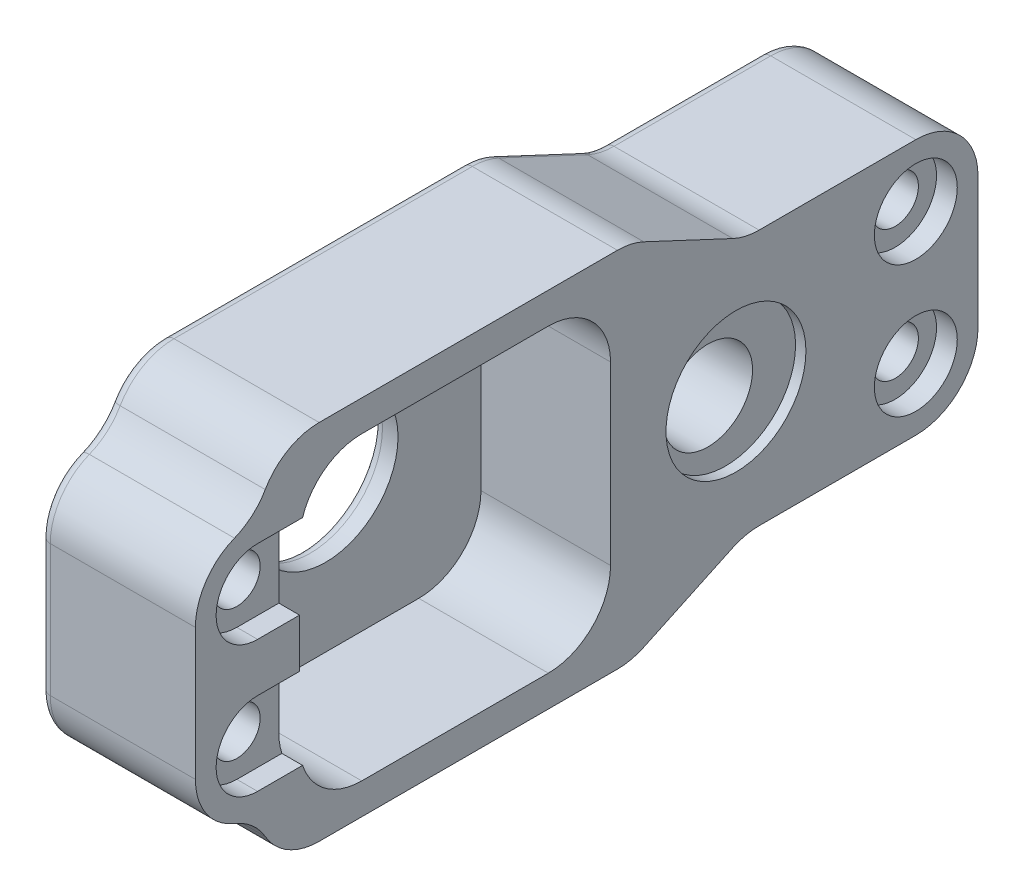
from build123d import *

# Parameters (mm, degrees)
SKETCH1_R           = 4.3
SKETCH1_R_2         = 2.25
SKETCH1_W           = 30
SKETCH1_H           = 29
BOSS_EXTRUDE1_DEPTH = 15
SKETCH1_3_W         = 30
SKETCH1_3_H         = 29
SKETCH1_3_R         = 7
BOSS_EXTRUDE2_DEPTH = 2.5
CUT_EXTRUDE1_START  = 14
SKETCH1_4_R         = 6.75
SKETCH1_4_R_2       = 4.3
CUT_EXTRUDE1_DEPTH  = 1
FILLET1_R           = 6
FILLET2_R           = 6
FILLET3_R           = 1
SKETCH2_R           = 4
CUT_EXTRUDE2_DEPTH  = 2


with BuildPart() as part:
    # Sketch1 → Boss-Extrude1 (new body)
    with BuildSketch(Plane(origin=(0, 0, 0), x_dir=(0, 0, -1), z_dir=(1, 0, 0))):
        Polygon((-19.05, 17.5), (17, 17.5), (28, 12.35), (50.45, 12.35), (50.45, -12.35), (28, -12.35), (17, -17.5), (-19.05, -17.5), (-19.05, -12.35), (-25.05, -12.35), (-25.05, 12.35), (-19.05, 12.35), align=None)
        with Locations((25.4, 0)):
            Circle(SKETCH1_R, mode=Mode.SUBTRACT)
        with Locations((-19.05, 6.35)):
            Circle(SKETCH1_R_2, mode=Mode.SUBTRACT)
        with Locations((44.45, 6.35)):
            Circle(SKETCH1_R_2, mode=Mode.SUBTRACT)
        with Locations((44.45, -6.35)):
            Circle(SKETCH1_R_2, mode=Mode.SUBTRACT)
        with Locations((-19.05, -6.35)):
            Circle(SKETCH1_R_2, mode=Mode.SUBTRACT)
        Rectangle(SKETCH1_W, SKETCH1_H, mode=Mode.SUBTRACT)
    extrude(amount=BOSS_EXTRUDE1_DEPTH)

    # Sketch1<3> → Boss-Extrude2 (add)
    with BuildSketch(Plane(origin=(0, 0, 0), x_dir=(0, 0, -1), z_dir=(1, 0, 0))):
        Rectangle(SKETCH1_3_W, SKETCH1_3_H)
        Circle(SKETCH1_3_R, mode=Mode.SUBTRACT)
    extrude(amount=BOSS_EXTRUDE2_DEPTH)

    # Sketch1<4> → Cut-Extrude1 (cut)
    with BuildSketch(Plane(origin=(0, 0, 0), x_dir=(0, 0, -1), z_dir=(1, 0, 0)).offset(CUT_EXTRUDE1_START)):
        with Locations((27.1, 0)):
            Circle(SKETCH1_4_R)
        with Locations((25.4, 0)):
            Circle(SKETCH1_4_R_2, mode=Mode.SUBTRACT)
    extrude(amount=CUT_EXTRUDE1_DEPTH, mode=Mode.SUBTRACT)

    # Fillet1
    # the kernel refuses this fillet: 6 mm, written as the material it adds along each edge
    with BuildSketch(Plane(origin=(2.5, -14.5, 15), x_dir=(0, 1, 0), z_dir=(1, 0, 0)), Plane(origin=(2.5, 14.5, 15), x_dir=(0, 0, -1), z_dir=(1, 0, 0))) as fillet1_piece_1:
        with BuildLine():
            CenterArc((FILLET1_R, -FILLET1_R), FILLET1_R, 90, 90)
            Line((0, -FILLET1_R), (0, 0))
            Line((0, 0), (FILLET1_R, 0))
        make_face()
    extrude(amount=12.5)
    with BuildSketch(Plane(origin=(2.5, -14.5, -15), x_dir=(0, 1, 0), z_dir=(1, 0, 0)), Plane(origin=(2.5, 14.5, -15), x_dir=(0, 0, 1), z_dir=(1, 0, 0))) as fillet1_piece_2:
        with BuildLine():
            CenterArc((FILLET1_R, FILLET1_R), FILLET1_R, 180, 90)
            Line((0, FILLET1_R), (0, 0))
            Line((0, 0), (FILLET1_R, 0))
        make_face()
    extrude(amount=12.5)
    with BuildSketch(Plane(origin=(0, -12.35, -28), x_dir=(0, 0, -1), z_dir=(1, 0, 0)), Plane(origin=(0, 12.35, -28), x_dir=(0, 0.42401195067886216, 0.9056565936830063), z_dir=(1, 0, 0))) as fillet1_piece_3:
        with BuildLine():
            CenterArc((FILLET1_R * 0.222501762429, -FILLET1_R), FILLET1_R, 90, 25.088139126)
            Line((-FILLET1_R * 0.20151018825, -FILLET1_R * 0.094343406317), (0, 0))
            Line((0, 0), (FILLET1_R * 0.222501762429, 0))
        make_face()
    extrude(amount=15)
    # the kernel refuses this fillet: 6 mm, written as the material it takes off along each edge
    with BuildSketch(Plane(origin=(-3.337526436, 17.5, -17), x_dir=(0, 0, 1), z_dir=(1, 0, 0)), Plane(origin=(-3.337526436, -17.5, -17), x_dir=(0, 0.4240119506788633, -0.9056565936830059), z_dir=(1, 0, 0))) as fillet1_2_piece_1:
        with BuildLine():
            CenterArc((FILLET1_R * 0.222501762429, FILLET1_R), FILLET1_R, 244.911860874, 25.088139126)
            Line((-FILLET1_R * 0.20151018825, FILLET1_R * 0.094343406317), (0, 0))
            Line((0, 0), (FILLET1_R * 0.222501762429, 0))
        make_face()
    extrude(amount=21.675052873, mode=Mode.SUBTRACT)
    with BuildSketch(Plane(origin=(-14.848716274, -17.5, 19.05), x_dir=(0, 0, -1), z_dir=(1, 0, 0))) as fillet1_2_piece_2:
        with BuildLine():
            CenterArc((5.93948651, 6), FILLET1_R, 188.144300554, 81.855699446)
            Line((0, 5.15), (0, 0))
            Line((0, 0), (5.93948651, 0))
        make_face()
    extrude(amount=44.697432549, mode=Mode.SUBTRACT)
    with BuildSketch(Plane(origin=(-14.848716274, 17.5, 19.05), x_dir=(0, 0, -1), z_dir=(1, 0, 0))) as fillet1_2_piece_3:
        with BuildLine():
            CenterArc((5.93948651, -6), FILLET1_R, 90, 81.855699446)
            Line((0, -5.15), (0, 0))
            Line((0, 0), (5.93948651, 0))
        make_face()
    extrude(amount=44.697432549, mode=Mode.SUBTRACT)
    with BuildSketch(Plane(origin=(-15, -12.35, 25.05), x_dir=(0, 0, -1), z_dir=(1, 0, 0)), Plane(origin=(-15, -12.35, -50.45), x_dir=(0, 1, 0), z_dir=(1, 0, 0)), Plane(origin=(-15, 12.35, -50.45), x_dir=(0, 0, 1), z_dir=(1, 0, 0))) as fillet1_2_piece_4:
        with BuildLine():
            CenterArc((FILLET1_R, FILLET1_R), FILLET1_R, 180, 90)
            Line((0, FILLET1_R), (0, 0))
            Line((0, 0), (FILLET1_R, 0))
        make_face()
    extrude(amount=45, mode=Mode.SUBTRACT)
    with BuildSketch(Plane(origin=(-15, 12.35, 25.05), x_dir=(0, 0, -1), z_dir=(1, 0, 0))) as fillet1_2_piece_5:
        with BuildLine():
            CenterArc((FILLET1_R, -FILLET1_R), FILLET1_R, 90, 90)
            Line((0, -FILLET1_R), (0, 0))
            Line((0, 0), (FILLET1_R, 0))
        make_face()
    extrude(amount=45, mode=Mode.SUBTRACT)

    # Fillet2
    fillet2_edges = [part.edges().sort_by_distance(p)[0] for p in [
        (7.5, -12.35, 19.05),
        (7.5, 12.35, 19.05),
    ]]
    fillet(fillet2_edges, radius=FILLET2_R)

    # Fillet3
    fillet3_edges = [part.edges().sort_by_distance(p)[0] for p in [
        (0, -12.35, -36.892505287),
        (0, -14.925, -22.5),
        (0, 14.925, -22.5),
        (0, 12.35, -36.892505287),
        (0, 17.5, -1.277237968),
        (0, 0, 25.05),
        (0, 0, -50.45),
        (0, -17.5, -1.277237968),
        (0, 10.592640687, -48.692640687),
        (0, -10.592640687, -48.692640687),
        (0, 9.713510284, 24.018581143),
        (0, -16.694889197, 16.112700398),
        (0, -17.356775451, -16.968132285),
        (0, 17.356775451, -16.968132285),
        (0, -12.493224549, -28.031867715),
        (0, 12.493224549, -28.031867715),
        (0, -9.713510284, 24.018581143),
        (0, 16.694889197, 16.112700398),
        (0, -12.958038397, 19.577216913),
        (0, 12.958038397, 19.577216913),
        (0, 0, -21.1),
        (0, 6.35, 21.3),
        (0, 6.35, -42.2),
        (0, -6.35, -42.2),
        (0, -6.35, 21.3),
        (0, 0, 7),
    ]]
    fillet(fillet3_edges, radius=FILLET3_R)

    # Sketch2 → Cut-Extrude2 (cut)
    with BuildSketch(Plane(origin=(15, 0, 0), x_dir=(0, 0, -1), z_dir=(1, 0, 0))):
        with Locations((44.45, -6.35)):
            Circle(SKETCH2_R)
        with Locations((44.45, 6.35)):
            Circle(SKETCH2_R)
        with BuildLine():
            Line((-19.05, 10.35), (-14.707670278, 10.35))
            Line((-14.707670278, 10.35), (-14.707670278, 2.35))
            Line((-14.707670278, 2.35), (-19.05, 2.35))
            ThreePointArc((-19.05, 2.35), (-23.05, 6.35), (-19.05, 10.35))
        make_face()
        with BuildLine():
            Line((-19.05, -10.35), (-14.707670278, -10.35))
            Line((-14.707670278, -10.35), (-14.707670278, -2.35))
            Line((-14.707670278, -2.35), (-19.05, -2.35))
            ThreePointArc((-19.05, -2.35), (-23.05, -6.35), (-19.05, -10.35))
        make_face()
    extrude(amount=-CUT_EXTRUDE2_DEPTH, mode=Mode.SUBTRACT)


solid = part.part
